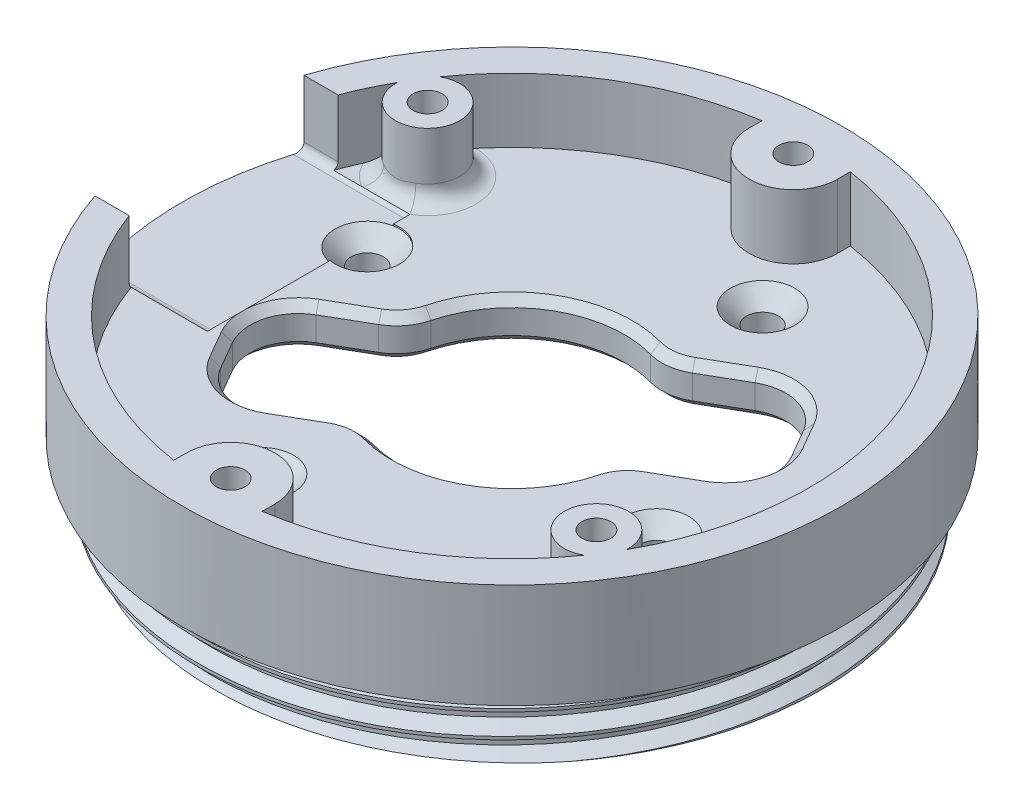
from build123d import *

# Parameters (mm, degrees)
SKETCH1_R           = 20.5
SKETCH1_R_2         = 7
SKETCH1_R_3         = 0.9
EXTRUDE1_DEPTH      = 2.5
SKETCH3_R           = 20.5
SKETCH3_R_2         = 0.9
EXTRUDE2_DEPTH      = 4
EXTRUDE3_DEPTH      = 4.1
SKETCH9_R           = 1
EXTRUDE5_DEPTH      = 1
SKETCH8_R           = 18.45
SKETCH8_R_2         = 17.5
EXTRUDE6_DEPTH      = 4
THREAD1_PITCH       = 1.5
THREAD1_FROM        = 2
FILLET4_R           = 0.5
SKETCH22_R          = 2
EXTRUDE9_DEPTH      = 4
SKETCH23_R          = 0.9
SKETCH23_R_2        = 1
EXTRUDE10_DEPTH     = 31.834234388
EXTRUDE12_DEPTH     = 30.711109193
FILLET5_R           = 3
CHAMFER2_SIZE       = 0.5
CHAMFER3_SIZE       = 1
FILLET6_R           = 1
SKETCH_2_R          = 2
CUT_EXTRUDE_1_DEPTH = 0.1
CHAMFER_1_SIZE      = 1


with BuildPart() as part:
    # Sketch1 → Extrude1 (new body)
    with BuildSketch(Plane(origin=(0, 0, 0), x_dir=(1, 0, 0), z_dir=(0, 1, 0))):
        with Locations(Location((0, 0, 0), (0, 0, 270))):
            Circle(SKETCH1_R)
        with Locations(Location((0, 0, 0), (0, 0, 270))):
            Circle(SKETCH1_R_2, mode=Mode.SUBTRACT)
        with Locations(Location((0, 17.5, 0), (0, 0, 270))):
            Circle(SKETCH1_R_3, mode=Mode.SUBTRACT)
        with Locations(Location((0, -17.5, 0), (0, 0, 270))):
            Circle(SKETCH1_R_3, mode=Mode.SUBTRACT)
    extrude(amount=EXTRUDE1_DEPTH)

    # Sketch3 → Extrude2 (add)
    with BuildSketch(Plane(origin=(0, 2.5, 0), x_dir=(1, 0, 0), z_dir=(0, 1, 0))):
        with Locations(Location((0, 0, 0), (0, 0, 270))):
            Circle(SKETCH3_R)
        with Locations(Location((0, 17.5, 0), (0, 0, 270))):
            Circle(SKETCH3_R_2, mode=Mode.SUBTRACT)
        with Locations(Location((0, -17.5, 0), (0, 0, 270))):
            Circle(SKETCH3_R_2, mode=Mode.SUBTRACT)
        with BuildLine():
            Line((-2.75, 17.5), (-2.75, 18.294466376))
            ThreePointArc((-2.75, 18.294466376), (-18.5, 0), (-2.75, -18.294466376))
            Line((-2.75, -18.294466376), (-2.75, -17.5))
            ThreePointArc((-2.75, -17.5), (0, -14.75), (2.75, -17.5))
            Line((2.75, -17.5), (2.75, -18.294466376))
            ThreePointArc((2.75, -18.294466376), (18.5, 0), (2.75, 18.294466376))
            Line((2.75, 18.294466376), (2.75, 17.5))
            ThreePointArc((2.75, 17.5), (0, 14.75), (-2.75, 17.5))
        make_face(mode=Mode.SUBTRACT)
    extrude(amount=EXTRUDE2_DEPTH)

    # Sketch4 → Extrude3 (cut)
    with BuildSketch(Plane(origin=(0, 6.5, 0), x_dir=(1, 0, 0), z_dir=(0, 1, 0))):
        Polygon((-20.5, 7.5), (-20.5, -7.5), (-19.65, -7.5), (-19.65, -6.5), (-12.65, -6.5), (-12.65, 6.5), (-19.65, 6.5), (-19.65, 7.5), align=None)
    extrude(amount=-EXTRUDE3_DEPTH, mode=Mode.SUBTRACT)

    # Sketch9 → Extrude5 (add)
    with BuildSketch(Plane.XZ):
        with Locations((0, 17.5)):
            Circle(SKETCH9_R)
        with Locations((0, -17.5)):
            Circle(SKETCH9_R)
    extrude(amount=-EXTRUDE5_DEPTH)

    # Sketch8 → Extrude6 (add)
    with BuildSketch(Plane.XZ):
        with Locations(Location((0, 0, 0), (0, 0, 90))):
            Circle(SKETCH8_R)
        with Locations(Location((0, 0, 0), (0, 0, 270))):
            Circle(SKETCH8_R_2, mode=Mode.SUBTRACT)
    extrude(amount=EXTRUDE6_DEPTH)

    # Thread1: arcs per turn and ends read off the stored shape
    # Thread1: the profile of Sketch11 profile screwed along a right-hand helix through 4 turns, 8 arcs to a turn; built about Z, then put on its axis
    thread1_z = Axis((0, 0, 0), (0, 0, 1))
    thread1_corners = [(18.4497, 0, -0.000173205), (19.261898813, 0, 0.468749998), (19.261898813, 0, 0.656249998), (18.4497, 0, 1.125173201)]
    with BuildLine(mode=Mode.PRIVATE) as thread1_profile:
        Line(thread1_corners[0], thread1_corners[1])
        Line(thread1_corners[1], thread1_corners[2])
        Line(thread1_corners[2], thread1_corners[3])
        Line(thread1_corners[3], thread1_corners[0])
    thread1_cap = Face(thread1_profile.wire())
    thread1_turn_angles = [0, 22.5, 45, 67.5, 90, 112.5, 135, 157.5, 180, 202.5, 225, 247.5, 270, 292.5, 315, 337.5, 360]
    thread1_turn_weights = [1, 0.9238795325112867, 1, 0.9238795325112867, 1, 0.9238795325112867, 1, 0.9238795325112867, 1, 0.9238795325112867, 1, 0.9238795325112867, 1, 0.9238795325112867, 1, 0.9238795325112867, 1]
    thread1_turn_rails = [Edge.make_bspline([Vector(p[0], p[1], 0).rotate(thread1_z, thread1_turn_angles[k]) / thread1_turn_weights[k] + Vector(0, 0, p[2] + THREAD1_PITCH * thread1_turn_angles[k] / 360) for k in range(17)], [0, 0, 0, 1, 1, 2, 2, 3, 3, 4, 4, 5, 5, 6, 6, 7, 7, 8, 8, 8], 2, thread1_turn_weights) for p in thread1_corners]
    thread1_turn_sides = [Face.make_surface_from_curves(thread1_turn_rails[p[0]], thread1_turn_rails[p[1]]) for p in [(0, 1), (1, 2), (2, 3), (3, 0)]]
    thread1 = Plane(origin=(0, -6, 0), x_dir=(1, 0, 0), z_dir=(0, 1, 0)) * split(Solid(Shell([*[p.moved(Location((0, 0, THREAD1_PITCH * i))) for i in range(4) for p in thread1_turn_sides], thread1_cap, thread1_cap.rotate(thread1_z, 1440).moved(Location((0, 0, THREAD1_PITCH * 1440 / 360)))])), bisect_by=Plane.XY.offset(THREAD1_FROM), keep=Keep.TOP, mode=Mode.PRIVATE)
    add(thread1)

    # Fillet4
    fillet4_edges = [part.edges().sort_by_distance(p)[0] for p in [
        (-16.046111048, 2.4, 6.5),
        (-16.046111048, 2.4, -6.5),
    ]]
    fillet(fillet4_edges, radius=FILLET4_R)

    # Sketch22 → Extrude9 (add)
    with BuildSketch(Plane(origin=(0, 2.5, 0), x_dir=(1, 0, 0), z_dir=(0, 1, 0))):
        with Locations((-14.15, 8.9)):
            Circle(SKETCH22_R)
        with Locations((14.15, -8.9)):
            Circle(SKETCH22_R)
    extrude(amount=EXTRUDE9_DEPTH)

    # Sketch23 → Extrude10 (cut, through all)
    with BuildSketch(Plane(origin=(0, 6.5, 0), x_dir=(1, 0, 0), z_dir=(0, 1, 0))):
        with Locations(Location((14.15, -8.9, 0), (0, 0, 270))):
            Circle(SKETCH23_R)
        with Locations(Location((-14.15, 8.9, 0), (0, 0, 270))):
            Circle(SKETCH23_R)
        with Locations(Location((3.294222924, 12.294207324, 0), (0, 0, 270))):
            Circle(SKETCH23_R_2)
        with Locations(Location((12.294207324, -3.294222924, 0), (0, 0, 270))):
            Circle(SKETCH23_R_2)
        with Locations(Location((-3.294222924, -12.294207324, 0), (0, 0, 270))):
            Circle(SKETCH23_R_2)
        with Locations(Location((-12.294207324, 3.294222924, 0), (0, 0, 270))):
            Circle(SKETCH23_R_2)
    extrude(amount=-EXTRUDE10_DEPTH, mode=Mode.SUBTRACT)

    # Sketch25 → Extrude12 (cut, through all)
    with BuildSketch(Plane(origin=(0, 2.5, 0), x_dir=(1, 0, 0), z_dir=(0, 1, 0))):
        Polygon((9.258330249, 9.964101615), (-13.258330249, -3.035898385), (-9.258330249, -9.964101615), (13.258330249, 3.035898385), align=None)
    extrude(amount=-EXTRUDE12_DEPTH, mode=Mode.SUBTRACT)

    # Fillet5
    # the kernel refuses this fillet: 3 mm, written as the material it adds along each edge
    with BuildSketch(Plane(origin=(-9.258330249, 2.5, 9.964101615), x_dir=(-0.5000000000000039, 0, -0.8660254037844364), z_dir=(0, -1, 0)), Plane(origin=(13.258330249, 2.5, -3.035898385), x_dir=(-0.8660254037844363, 0, 0.5000000000000043), z_dir=(0, -1, 0)), Plane(origin=(9.258330249, 2.5, -9.964101615), x_dir=(0.5000000000000039, 0, 0.8660254037844364), z_dir=(0, -1, 0))) as fillet5_piece_1:
        with BuildLine():
            CenterArc((FILLET5_R, FILLET5_R), FILLET5_R, 180, 90)
            Line((0, FILLET5_R), (0, 0))
            Line((0, 0), (FILLET5_R, 0))
        make_face()
    extrude(amount=2.5)
    with BuildSketch(Plane(origin=(-13.258330249, 9.9, 3.035898385), x_dir=(0.5000000000000037, 0, 0.8660254037844366), z_dir=(0, -1, 0))) as fillet5_piece_2_section:
        with BuildLine():
            CenterArc((FILLET5_R, -FILLET5_R), FILLET5_R, 90, 90)
            Line((0, -FILLET5_R), (0, 0))
            Line((0, 0), (FILLET5_R, 0))
        make_face()
    fillet5_piece_2 = extrude(amount=9.9, mode=Mode.PRIVATE)
    fillet5_piece_2 = split(fillet5_piece_2, bisect_by=Plane(origin=(-13.258330249, 2.5, 3.035898385), z_dir=(0, -1, 0)), keep=Keep.TOP, mode=Mode.PRIVATE)
    fillet5_piece_2 = split(fillet5_piece_2, bisect_by=Plane(origin=(-13.258330249, 2.4, 3.035898385), z_dir=(0, 1, 0)), keep=Keep.TOP, mode=Mode.PRIVATE)
    fillet5_piece_2 = split(fillet5_piece_2, bisect_by=Plane(origin=(-12.65, 9.9, 3.035898385), z_dir=(1, 0, 0)), keep=Keep.TOP, mode=Mode.PRIVATE)
    add(fillet5_piece_2)
    with BuildSketch(Plane(origin=(-13.258330249, 2.4, 3.035898385), x_dir=(0.5000000000000037, 0, 0.8660254037844366), z_dir=(0, -1, 0))) as fillet5_piece_3_section:
        with BuildLine():
            CenterArc((FILLET5_R, -FILLET5_R), FILLET5_R, 90, 90)
            Line((0, -FILLET5_R), (0, 0))
            Line((0, 0), (FILLET5_R, 0))
        make_face()
    fillet5_piece_3 = extrude(amount=2.4, mode=Mode.PRIVATE)
    fillet5_piece_3 = split(fillet5_piece_3, bisect_by=Plane(origin=(-12.65, 2.4, 3.035898385), z_dir=(1, 0, 0)), keep=Keep.TOP, mode=Mode.PRIVATE)
    add(fillet5_piece_3)
    with BuildSketch(Plane(origin=(-13.258330249, 2.4, 3.035898385), x_dir=(0.5000000000000037, 0, 0.8660254037844366), z_dir=(0, -1, 0))) as fillet5_piece_4_section:
        with BuildLine():
            CenterArc((FILLET5_R, -FILLET5_R), FILLET5_R, 90, 90)
            Line((0, -FILLET5_R), (0, 0))
            Line((0, 0), (FILLET5_R, 0))
        make_face()
    fillet5_piece_4 = extrude(amount=2.4, mode=Mode.PRIVATE)
    fillet5_piece_4 = split(fillet5_piece_4, bisect_by=Plane(origin=(-12.65, 2.4, 3.035898385), z_dir=(-1, 0, 0)), keep=Keep.TOP, mode=Mode.PRIVATE)
    add(fillet5_piece_4)
    # the kernel refuses this fillet: 3 mm, written as the material it takes off along each edge
    with BuildSketch(Plane(origin=(-2.974937186, 5.992164455, 6.336382938), x_dir=(-0.8660254037844369, 0, 0.5000000000000029), z_dir=(0, -1, 0)), Plane(origin=(2.974937186, 5.992164455, -6.336382938), x_dir=(0.8660254037844373, 0, -0.5000000000000023), z_dir=(0, -1, 0))) as fillet5_2_piece_1:
        with BuildLine():
            CenterArc((1.396865782, -3), FILLET5_R, 90, 45.572995999)
            ThreePointArc((-0.745562747, -0.9), (-0.353965829, -0.465586854), (0, 0))
            Line((0, 0), (1.396865782, 0))
        make_face()
    extrude(amount=9.48432891, mode=Mode.SUBTRACT)
    with BuildSketch(Plane(origin=(6.974937186, 5.992164455, 0.591820292), x_dir=(-0.16743046426122363, 0, 0.9858838875026162), z_dir=(0, -1, 0)), Plane(origin=(-6.974937186, 5.992164455, -0.591820292), x_dir=(0.16743046426122418, 0, -0.9858838875026161), z_dir=(0, -1, 0))) as fillet5_2_piece_2:
        with BuildLine():
            CenterArc((1.419137854, -2.989528686), FILLET5_R, 94.788549711, 45.572995999)
            Line((-0.891117925, -1.075705748), (0, 0))
            ThreePointArc((0, 0), (0.584350881, -0.024433066), (1.168701762, 0))
        make_face()
    extrude(amount=9.48432891, mode=Mode.SUBTRACT)

    # Chamfer2
    # the kernel refuses this chamfer: 0.5 mm, written as the material it takes off along each edge
    with BuildSketch(Plane(origin=(8.184658438, 2.5, -0.106612599), x_dir=(0.5000000000000038, 0, 0.8660254037844365), z_dir=(0.8660254037844365, 0, -0.5000000000000038)), Plane(origin=(-6.660254038, 2.5, 8.464101615), x_dir=(0.5000000000000039, 0, 0.8660254037844366), z_dir=(0.8660254037844365, 0, -0.5000000000000038)), Plane(origin=(-8.184658438, 2.5, 0.106612599), x_dir=(-0.5000000000000038, 0, -0.8660254037844365), z_dir=(-0.8660254037844365, 0, 0.5000000000000038)), Plane(origin=(6.660254038, 2.5, -8.464101615), x_dir=(-0.5000000000000038, 0, -0.8660254037844366), z_dir=(-0.8660254037844365, 0, 0.5000000000000038))) as chamfer2_piece_1:
        Polygon((CHAMFER2_SIZE, 0), (0, CHAMFER2_SIZE), (0, 0), align=None)
    extrude(amount=2.858571571, mode=Mode.SUBTRACT)
    with BuildSketch(Plane(origin=(8.184658438, 0, -0.106612599), x_dir=(0.5000000000000038, 0, 0.8660254037844365), z_dir=(0.8660254037844365, 0, -0.5000000000000038)), Plane(origin=(6.660254038, 0, -8.464101615), x_dir=(-0.5000000000000038, 0, -0.8660254037844365), z_dir=(-0.8660254037844365, 0, 0.5000000000000038)), Plane(origin=(-8.184658438, 0, 0.106612599), x_dir=(-0.5000000000000039, 0, -0.8660254037844366), z_dir=(-0.8660254037844365, 0, 0.5000000000000038)), Plane(origin=(-6.660254038, 0, 8.464101615), x_dir=(0.5000000000000039, 0, 0.8660254037844365), z_dir=(0.8660254037844365, 0, -0.5000000000000038))) as chamfer2_piece_2:
        Polygon((CHAMFER2_SIZE, 0), (0, -CHAMFER2_SIZE), (0, 0), align=None)
    extrude(amount=2.858571571, mode=Mode.SUBTRACT)
    with BuildSketch(Plane(origin=(-11.758330249, 2.5, 5.633974596), x_dir=(-0.8660254037844366, 0, 0.5000000000000038), z_dir=(0.5000000000000038, 0, 0.8660254037844366)), Plane(origin=(11.758330249, 2.5, -5.633974596), x_dir=(0.8660254037844366, 0, -0.5000000000000037), z_dir=(-0.5000000000000037, 0, -0.8660254037844366))) as chamfer2_piece_3:
        Polygon((CHAMFER2_SIZE, 0), (0, CHAMFER2_SIZE), (0, 0), align=None)
    extrude(amount=2, mode=Mode.SUBTRACT)
    with BuildSketch(Plane(origin=(0, 2.5, 0), x_dir=(0.26846584384318783, 0, -0.9632892040760994), z_dir=(0.9632892040760994, 0, 0.26846584384318783))) as chamfer2_piece_4:
        Polygon((7 + CHAMFER2_SIZE, 0), (7, -CHAMFER2_SIZE), (7, 0), align=None)
    revolve(axis=Axis((0, 2.5, 0), (0, 1, 0)), revolution_arc=91.145991998, mode=Mode.SUBTRACT)
    with BuildSketch(Plane(origin=(0, 2.5, 0), x_dir=(0.9684658438428112, 0, 0.24914636122133413), z_dir=(0.24914636122133413, 0, -0.9684658438428112))) as chamfer2_piece_5:
        Polygon((7 + CHAMFER2_SIZE, 0), (7, CHAMFER2_SIZE), (7, 0), align=None)
    revolve(axis=Axis((0, 2.5, 0), (0, -1, 0)), revolution_arc=91.145991998, mode=Mode.SUBTRACT)
    with BuildSketch(Plane(origin=(-2.684658438, 2.5, 9.632892041), x_dir=(0.2684658438430212, 0, -0.9632892040761458), z_dir=(0.9632892040761458, 0, 0.2684658438430212))) as chamfer2_piece_6:
        Polygon((3 - CHAMFER2_SIZE, 0), (3, -CHAMFER2_SIZE), (3, 0), align=None)
    revolve(axis=Axis((-2.684658438, 2.5, 9.632892041), (0, 1, 0)), revolution_arc=45.572995999, mode=Mode.SUBTRACT)
    with BuildSketch(Plane(origin=(-9.684658438, 2.5, -2.491463612), x_dir=(0.49999999999898664, 0, 0.8660254037850236), z_dir=(-0.8660254037850236, 0, 0.49999999999898664))) as chamfer2_piece_7:
        Polygon((3 - CHAMFER2_SIZE, 0), (3, -CHAMFER2_SIZE), (3, 0), align=None)
    revolve(axis=Axis((-9.684658438, 2.5, -2.491463612), (0, 1, 0)), revolution_arc=45.572995999, mode=Mode.SUBTRACT)
    with BuildSketch(Plane(origin=(2.684658438, 2.5, -9.632892041), x_dir=(-0.2684658438430212, 0, 0.9632892040761458), z_dir=(-0.9632892040761458, 0, -0.2684658438430212))) as chamfer2_piece_8:
        Polygon((3 - CHAMFER2_SIZE, 0), (3, -CHAMFER2_SIZE), (3, 0), align=None)
    revolve(axis=Axis((2.684658438, 2.5, -9.632892041), (0, 1, 0)), revolution_arc=45.572995999, mode=Mode.SUBTRACT)
    with BuildSketch(Plane(origin=(9.684658438, 2.5, 2.491463612), x_dir=(-0.49999999999898664, 0, -0.8660254037850236), z_dir=(0.8660254037850236, 0, -0.49999999999898664))) as chamfer2_piece_9:
        Polygon((3 - CHAMFER2_SIZE, 0), (3, -CHAMFER2_SIZE), (3, 0), align=None)
    revolve(axis=Axis((9.684658438, 2.5, 2.491463612), (0, 1, 0)), revolution_arc=45.572995999, mode=Mode.SUBTRACT)
    with BuildSketch(Plane(origin=(0, 0, 0), x_dir=(0.9684658438428112, 0, 0.2491463612213341), z_dir=(0.2491463612213341, 0, -0.9684658438428112))) as chamfer2_piece_10:
        Polygon((7 + CHAMFER2_SIZE, 0), (7, -CHAMFER2_SIZE), (7, 0), align=None)
    revolve(axis=Axis((0, 0, 0), (0, -1, 0)), revolution_arc=91.145991998, mode=Mode.SUBTRACT)
    with BuildSketch(Plane(origin=(11.758330249, 0, -5.633974596), x_dir=(0.8660254037844365, 0, -0.5000000000000036), z_dir=(-0.5000000000000037, 0, -0.8660254037844366)), Plane(origin=(-11.758330249, 0, 5.633974596), x_dir=(-0.8660254037844365, 0, 0.5000000000000038), z_dir=(0.5000000000000038, 0, 0.8660254037844366))) as chamfer2_piece_11:
        Polygon((CHAMFER2_SIZE, 0), (0, -CHAMFER2_SIZE), (0, 0), align=None)
    extrude(amount=2, mode=Mode.SUBTRACT)
    with BuildSketch(Plane(origin=(0, 0, 0), x_dir=(0.26846584384318783, 0, -0.9632892040760994), z_dir=(0.9632892040760994, 0, 0.26846584384318783))) as chamfer2_piece_12:
        Polygon((7 + CHAMFER2_SIZE, 0), (7, CHAMFER2_SIZE), (7, 0), align=None)
    revolve(axis=Axis((0, 0, 0), (0, 1, 0)), revolution_arc=91.145991998, mode=Mode.SUBTRACT)
    with BuildSketch(Plane(origin=(-2.684658438, 0, 9.632892041), x_dir=(0.2684658438430212, 0, -0.9632892040761458), z_dir=(0.9632892040761458, 0, 0.2684658438430212))) as chamfer2_piece_13:
        Polygon((3 - CHAMFER2_SIZE, 0), (3, CHAMFER2_SIZE), (3, 0), align=None)
    revolve(axis=Axis((-2.684658438, 0, 9.632892041), (0, 1, 0)), revolution_arc=45.572995999, mode=Mode.SUBTRACT)
    with BuildSketch(Plane(origin=(-9.684658438, 0, -2.491463612), x_dir=(0.49999999999898664, 0, 0.8660254037850236), z_dir=(-0.8660254037850236, 0, 0.49999999999898664))) as chamfer2_piece_14:
        Polygon((3 - CHAMFER2_SIZE, 0), (3, CHAMFER2_SIZE), (3, 0), align=None)
    revolve(axis=Axis((-9.684658438, 0, -2.491463612), (0, 1, 0)), revolution_arc=45.572995999, mode=Mode.SUBTRACT)
    with BuildSketch(Plane(origin=(2.684658438, 0, -9.632892041), x_dir=(-0.2684658438430212, 0, 0.9632892040761458), z_dir=(-0.9632892040761458, 0, -0.2684658438430212))) as chamfer2_piece_15:
        Polygon((3 - CHAMFER2_SIZE, 0), (3, CHAMFER2_SIZE), (3, 0), align=None)
    revolve(axis=Axis((2.684658438, 0, -9.632892041), (0, 1, 0)), revolution_arc=45.572995999, mode=Mode.SUBTRACT)
    with BuildSketch(Plane(origin=(9.684658438, 0, 2.491463612), x_dir=(-0.49999999999898664, 0, -0.8660254037850236), z_dir=(0.8660254037850236, 0, -0.49999999999898664))) as chamfer2_piece_16:
        Polygon((3 - CHAMFER2_SIZE, 0), (3, CHAMFER2_SIZE), (3, 0), align=None)
    revolve(axis=Axis((9.684658438, 0, 2.491463612), (0, 1, 0)), revolution_arc=45.572995999, mode=Mode.SUBTRACT)
    with BuildSketch(Plane(origin=(-8.160254038, 2.5, 5.866025404), x_dir=(0.5000000000001902, 0, 0.8660254037843289), z_dir=(0.8660254037843289, 0, -0.5000000000001902))) as chamfer2_piece_17:
        Polygon((3 + CHAMFER2_SIZE, 0), (3, CHAMFER2_SIZE), (3, 0), align=None)
    revolve(axis=Axis((-8.160254038, 2.5, 5.866025404), (0, -1, 0)), revolution_arc=90, mode=Mode.SUBTRACT)
    with BuildSketch(Plane(origin=(-8.160254038, 0, 5.866025404), x_dir=(0.5000000000001902, 0, 0.8660254037843289), z_dir=(0.8660254037843289, 0, -0.5000000000001902))) as chamfer2_piece_18:
        Polygon((3 + CHAMFER2_SIZE, 0), (3, -CHAMFER2_SIZE), (3, 0), align=None)
    revolve(axis=Axis((-8.160254038, 0, 5.866025404), (0, -1, 0)), revolution_arc=90, mode=Mode.SUBTRACT)
    with BuildSketch(Plane(origin=(-9.160254038, 2.5, 4.133974596), x_dir=(-0.50000000000019, 0, -0.8660254037843289), z_dir=(0.8660254037843289, 0, -0.50000000000019))) as chamfer2_piece_19:
        Polygon((3 + CHAMFER2_SIZE, 0), (3, -CHAMFER2_SIZE), (3, 0), align=None)
    revolve(axis=Axis((-9.160254038, 2.5, 4.133974596), (0, 1, 0)), revolution_arc=90, mode=Mode.SUBTRACT)
    with BuildSketch(Plane(origin=(-9.160254038, 0, 4.133974596), x_dir=(-0.866025403784329, 0, 0.50000000000019), z_dir=(0.50000000000019, 0, 0.866025403784329))) as chamfer2_piece_20:
        Polygon((3 + CHAMFER2_SIZE, 0), (3, -CHAMFER2_SIZE), (3, 0), align=None)
    revolve(axis=Axis((-9.160254038, 0, 4.133974596), (0, -1, 0)), revolution_arc=90, mode=Mode.SUBTRACT)
    with BuildSketch(Plane(origin=(9.160254038, 2.5, -4.133974596), x_dir=(0.866025403784329, 0, -0.50000000000019), z_dir=(-0.50000000000019, 0, -0.866025403784329))) as chamfer2_piece_21:
        Polygon((3 + CHAMFER2_SIZE, 0), (3, CHAMFER2_SIZE), (3, 0), align=None)
    revolve(axis=Axis((9.160254038, 2.5, -4.133974596), (0, -1, 0)), revolution_arc=90, mode=Mode.SUBTRACT)
    with BuildSketch(Plane(origin=(9.160254038, 0, -4.133974596), x_dir=(0.866025403784329, 0, -0.50000000000019), z_dir=(-0.50000000000019, 0, -0.866025403784329))) as chamfer2_piece_22:
        Polygon((3 + CHAMFER2_SIZE, 0), (3, -CHAMFER2_SIZE), (3, 0), align=None)
    revolve(axis=Axis((9.160254038, 0, -4.133974596), (0, -1, 0)), revolution_arc=90, mode=Mode.SUBTRACT)
    with BuildSketch(Plane(origin=(8.160254038, 2.5, -5.866025404), x_dir=(-0.5000000000001902, 0, -0.8660254037843289), z_dir=(-0.8660254037843289, 0, 0.5000000000001902))) as chamfer2_piece_23:
        Polygon((3 + CHAMFER2_SIZE, 0), (3, CHAMFER2_SIZE), (3, 0), align=None)
    revolve(axis=Axis((8.160254038, 2.5, -5.866025404), (0, -1, 0)), revolution_arc=90, mode=Mode.SUBTRACT)
    with BuildSketch(Plane(origin=(8.160254038, 0, -5.866025404), x_dir=(-0.5000000000001902, 0, -0.8660254037843289), z_dir=(-0.8660254037843289, 0, 0.5000000000001902))) as chamfer2_piece_24:
        Polygon((3 + CHAMFER2_SIZE, 0), (3, -CHAMFER2_SIZE), (3, 0), align=None)
    revolve(axis=Axis((8.160254038, 0, -5.866025404), (0, -1, 0)), revolution_arc=90, mode=Mode.SUBTRACT)

    # Chamfer3
    chamfer3_edges = [part.edges().sort_by_distance(p)[0] for p in [
        (3.294222924, 2.5, -13.294207324),
        (12.294207324, 2.5, 2.294222924),
        (-3.294222924, 2.5, 11.294207324),
    ]]
    chamfer(chamfer3_edges, length=CHAMFER3_SIZE)

    # Fillet6
    fillet6_edges = [part.edges().sort_by_distance(p)[0] for p in [
        (-12.457035009, 2.5, -7.835166896),
        (12.457035009, 2.5, 7.835166896),
    ]]
    fillet(fillet6_edges, radius=FILLET6_R)

    # Эскиз2 → Вырез-Вытянуть1 (cut)
    with BuildSketch(Plane(origin=(0, 2.4, 0), x_dir=(1, 0, 0), z_dir=(0, 1, 0))):
        with Locations((-12.294207324, 3.294222924)):
            Circle(SKETCH_2_R)
    extrude(amount=CUT_EXTRUDE_1_DEPTH, mode=Mode.SUBTRACT)

    # Фаска1
    chamfer_1_edges = [part.edges().sort_by_distance(p)[0] for p in [
        (-12.294207324, 2.4, -4.294222924),
    ]]
    chamfer(chamfer_1_edges, length=CHAMFER_1_SIZE - 0.0001)  # a hair under: the kernel refuses the full size


solid = part.part
